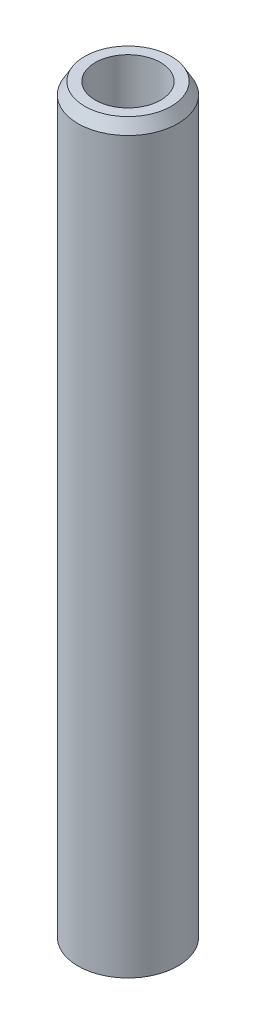
from build123d import *
from OCP.BRepFilletAPI import BRepFilletAPI_MakeChamfer

# Parameters (mm, degrees)
SKETCH1_R           = 12.5
BOSS_EXTRUDE1_DEPTH = 187.048750883
SKETCH2_R           = 8.168661721
CUT_EXTRUDE1_DEPTH  = 188.882237603
CHAMFER1_SIZE       = 2.912006746
CHAMFER1_SIZE2      = 1.681247879


with BuildPart() as part:
    # Sketch1 → Boss-Extrude1 (new body)
    with BuildSketch(Plane(origin=(0, 0, 0), x_dir=(1, 0, 0), z_dir=(0, 1, 0))):
        Circle(SKETCH1_R)
    extrude(amount=BOSS_EXTRUDE1_DEPTH)

    # Sketch2 → Cut-Extrude1 (cut, through all)
    with BuildSketch(Plane(origin=(0, 0, 0), x_dir=(1, 0, 0), z_dir=(0, 1, 0))):
        Circle(SKETCH2_R)
    extrude(amount=CUT_EXTRUDE1_DEPTH, mode=Mode.SUBTRACT)

    # Chamfer1: one chamfer whose edges measure the first distance from different faces: ONE call of the kernel's chamfer builder (chamfer() names one face for all edges)
    chamfer1_edges_1 = [part.edges().sort_by_distance(p)[0] for p in [
        (-12.5, 187.048750883, 0),
    ]]
    chamfer1_side_1 = [part.faces().sort_by_distance(p)[0] for p in [
        (-12.5, 93.524375442, 0),
    ]]
    chamfer1_edges_2 = [part.edges().sort_by_distance(p)[0] for p in [
        (-12.5, 0, 0),
    ]]
    chamfer1_side_2 = [part.faces().sort_by_distance(p)[0] for p in [
        (-12.146446609, 0, 0),
    ]]
    chamfer1 = BRepFilletAPI_MakeChamfer(part.part.solid().wrapped)
    for e in chamfer1_edges_1:
        chamfer1.Add(CHAMFER1_SIZE, CHAMFER1_SIZE2, e.wrapped, chamfer1_side_1[0].wrapped)  # the first distance lies on this face
    for e in chamfer1_edges_2:
        chamfer1.Add(CHAMFER1_SIZE, CHAMFER1_SIZE2, e.wrapped, chamfer1_side_2[0].wrapped)  # the first distance lies on this face
    add(Compound.cast(chamfer1.Shape()), mode=Mode.REPLACE)


solid = part.part
